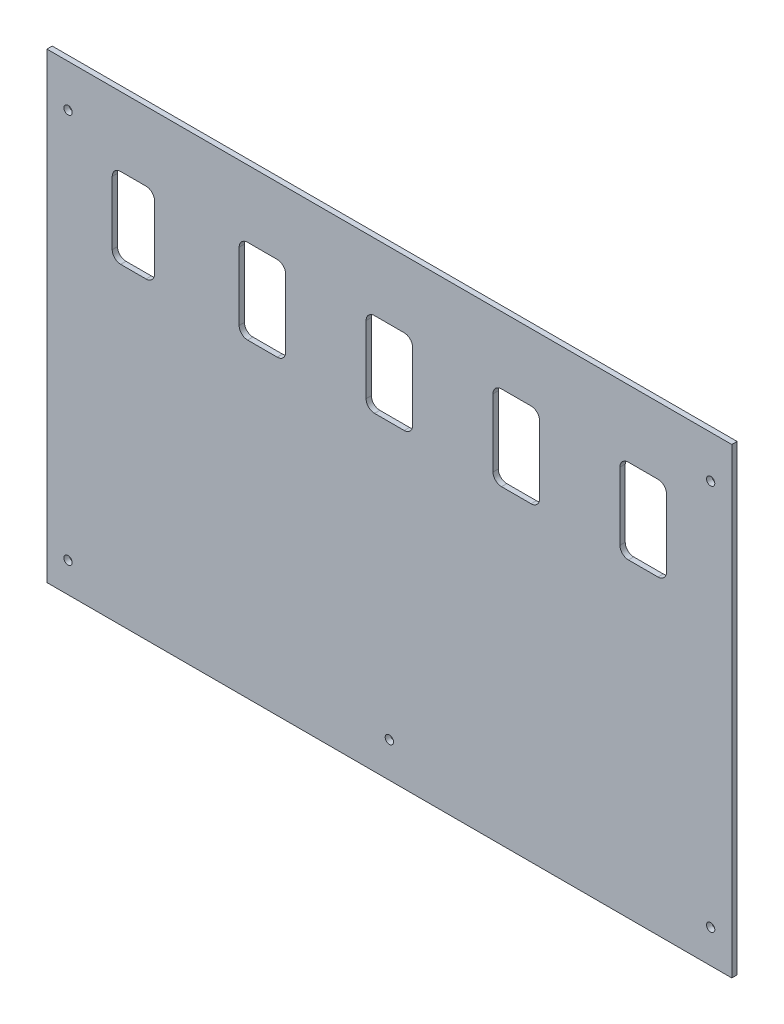
from build123d import *

# Parameters (mm, degrees)
SKETCH3_W              = 411.1625
SKETCH3_H              = 277.368
BOSS_EXTRUDE1_DEPTH    = 1.5875
CUT_EXTRUDE1_DEPTH     = 25.4
F_10_CLEARANCE_HOLE1_D = 4.9784
F_10_CLEARANCE_HOLE2_D = 4.9784


with BuildPart() as part:
    # Sketch3 → Boss-Extrude1 (new, symmetric)
    with BuildSketch(Plane.XY):
        Rectangle(SKETCH3_W, SKETCH3_H)
    extrude(amount=BOSS_EXTRUDE1_DEPTH, both=True)

    # Sketch4 → Cut-Extrude1 (cut)
    with BuildSketch(Plane.XY.offset(1.5875)):
        with BuildLine():
            Line((8.89, 98.4326708), (-8.89, 98.4326708))
            ThreePointArc((-8.89, 98.4326708), (-12.482102448, 96.944773248), (-13.97, 93.3526708))
            Line((-13.97, 93.3526708), (-13.97, 52.7126708))
            ThreePointArc((-13.97, 52.7126708), (-12.482102448, 49.120568352), (-8.89, 47.6326708))
            Line((-8.89, 47.6326708), (8.89, 47.6326708))
            ThreePointArc((8.89, 47.6326708), (12.482102448, 49.120568352), (13.97, 52.7126708))
            Line((13.97, 52.7126708), (13.97, 93.3526708))
            ThreePointArc((13.97, 93.3526708), (12.482102448, 96.944773248), (8.89, 98.4326708))
        make_face()
        with BuildLine():
            Line((85.09, 98.4326708), (67.31, 98.4326708))
            ThreePointArc((67.31, 98.4326708), (63.717897552, 96.944773248), (62.23, 93.3526708))
            Line((62.23, 93.3526708), (62.23, 52.7126708))
            ThreePointArc((62.23, 52.7126708), (63.717897552, 49.120568352), (67.31, 47.6326708))
            Line((67.31, 47.6326708), (85.09, 47.6326708))
            ThreePointArc((85.09, 47.6326708), (88.682102448, 49.120568352), (90.17, 52.7126708))
            Line((90.17, 52.7126708), (90.17, 93.3526708))
            ThreePointArc((90.17, 93.3526708), (88.682102448, 96.944773248), (85.09, 98.4326708))
        make_face()
        with BuildLine():
            Line((161.29, 98.4326708), (143.51, 98.4326708))
            ThreePointArc((143.51, 98.4326708), (139.917897552, 96.944773248), (138.43, 93.3526708))
            Line((138.43, 93.3526708), (138.43, 52.7126708))
            ThreePointArc((138.43, 52.7126708), (139.917897552, 49.120568352), (143.51, 47.6326708))
            Line((143.51, 47.6326708), (161.29, 47.6326708))
            ThreePointArc((161.29, 47.6326708), (164.882102448, 49.120568352), (166.37, 52.7126708))
            Line((166.37, 52.7126708), (166.37, 93.3526708))
            ThreePointArc((166.37, 93.3526708), (164.882102448, 96.944773248), (161.29, 98.4326708))
        make_face()
        with BuildLine():
            Line((-67.31, 98.4326708), (-85.09, 98.4326708))
            ThreePointArc((-85.09, 98.4326708), (-88.682102448, 96.944773248), (-90.17, 93.3526708))
            Line((-90.17, 93.3526708), (-90.17, 52.7126708))
            ThreePointArc((-90.17, 52.7126708), (-88.682102448, 49.120568352), (-85.09, 47.6326708))
            Line((-85.09, 47.6326708), (-67.31, 47.6326708))
            ThreePointArc((-67.31, 47.6326708), (-63.717897552, 49.120568352), (-62.23, 52.7126708))
            Line((-62.23, 52.7126708), (-62.23, 93.3526708))
            ThreePointArc((-62.23, 93.3526708), (-63.717897552, 96.944773248), (-67.31, 98.4326708))
        make_face()
        with BuildLine():
            Line((-146.05, 97.1626708), (-161.29, 97.1626708))
            ThreePointArc((-161.29, 97.1626708), (-164.882102448, 95.674773248), (-166.37, 92.0826708))
            Line((-166.37, 92.0826708), (-166.37, 53.9826708))
            ThreePointArc((-166.37, 53.9826708), (-164.882102448, 50.390568352), (-161.29, 48.9026708))
            Line((-161.29, 48.9026708), (-146.05, 48.9026708))
            ThreePointArc((-146.05, 48.9026708), (-142.457897552, 50.390568352), (-140.97, 53.9826708))
            Line((-140.97, 53.9826708), (-140.97, 92.0826708))
            ThreePointArc((-140.97, 92.0826708), (-142.457897552, 95.674773248), (-146.05, 97.1626708))
        make_face()
    extrude(amount=-CUT_EXTRUDE1_DEPTH, mode=Mode.SUBTRACT)

    # #10 Clearance Hole1 (through all)
    with Locations(Plane.XY.offset(1.5875)):
        with Locations((192.88125, 113.284), (-192.88125, -120.764157335), (192.88125, -118.647541008), (-192.88125, 113.284)):
            Hole(F_10_CLEARANCE_HOLE1_D / 2)

    # #10 Clearance Hole2 (through all)
    with Locations(Plane.XY.offset(1.5875)):
        with Locations((0, -117.532545274)):
            Hole(F_10_CLEARANCE_HOLE2_D / 2)


solid = part.part
